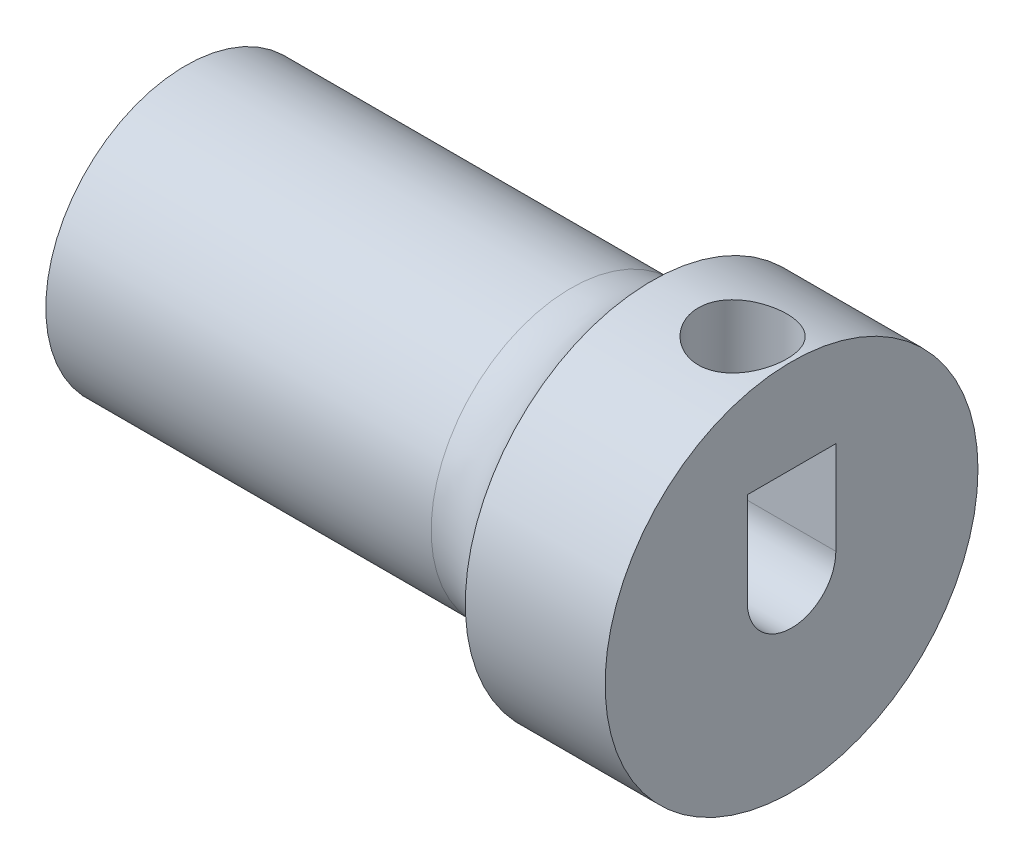
from build123d import *

# Parameters (mm, degrees)
SKETCH2_R           = 3
BOSS_EXTRUDE1_DEPTH = 10
SKETCH3_R           = 4
BOSS_EXTRUDE2_DEPTH = 3
FILLET1_R           = 2
CUT_EXTRUDE1_DEPTH  = 2
SKETCH6_R           = 0.95
CUT_EXTRUDE2_DEPTH  = 15.866068747


with BuildPart() as part:
    # Sketch2 → Boss-Extrude1 (new body)
    with BuildSketch(Plane(origin=(0, 0, 0), x_dir=(0, 0, -1), z_dir=(1, 0, 0))):
        Circle(SKETCH2_R)
        with BuildLine():
            Line((-1.322875656, 1.5), (1.322875656, 1.5))
            ThreePointArc((1.322875656, 1.5), (0, -2), (-1.322875656, 1.5))
        make_face(mode=Mode.SUBTRACT)
    extrude(amount=BOSS_EXTRUDE1_DEPTH)

    # Sketch3 → Boss-Extrude2 (add)
    with BuildSketch(Plane(origin=(10, 0, 0), x_dir=(0, 0, -1), z_dir=(1, 0, 0))):
        Circle(SKETCH3_R)
    extrude(amount=BOSS_EXTRUDE2_DEPTH)

    # Fillet1
    # the kernel refuses this fillet: 2 mm, written as the material it adds along each edge
    with BuildSketch(Plane(origin=(10, 0, 0), x_dir=(0, 0, -1), z_dir=(0, -1, 0))) as fillet1_piece_1:
        with BuildLine():
            CenterArc((5, -1.732050808), FILLET1_R, 120, 60)
            Line((3, -1.732050808), (2.96, -1.732050808))
            Line((2.96, -1.732050808), (2.96, 0))
            Line((2.96, 0), (3, 0.04))
            ThreePointArc((3, 0.04), (3.5, 0.04), (3.98, 0.034641016))
            Line((3.98, 0.034641016), (4, 0))
        make_face()
    revolve(axis=Axis((10, 0, 0), (1, 0, 0)))

    # Sketch4 → Cut-Extrude1 (cut)
    with BuildSketch(Plane(origin=(13, 0, 0), x_dir=(0, 0, -1), z_dir=(1, 0, 0))):
        with BuildLine():
            Line((-0.95, 2), (-0.95, 0))
            ThreePointArc((-0.95, 0), (0, -0.95), (0.95, 0))
            Line((0.95, 0), (0.95, 2))
            Line((0.95, 2), (-0.95, 2))
        make_face()
    extrude(amount=-CUT_EXTRUDE1_DEPTH, mode=Mode.SUBTRACT)

    # Sketch6 → Cut-Extrude2 (cut, through all)
    with BuildSketch(Plane(origin=(0, 2, 0), x_dir=(-1, 0, 0), z_dir=(0, -1, 0))):
        with Locations((-11.95, 0)):
            Circle(SKETCH6_R)
    extrude(amount=-CUT_EXTRUDE2_DEPTH, mode=Mode.SUBTRACT)


solid = part.part
